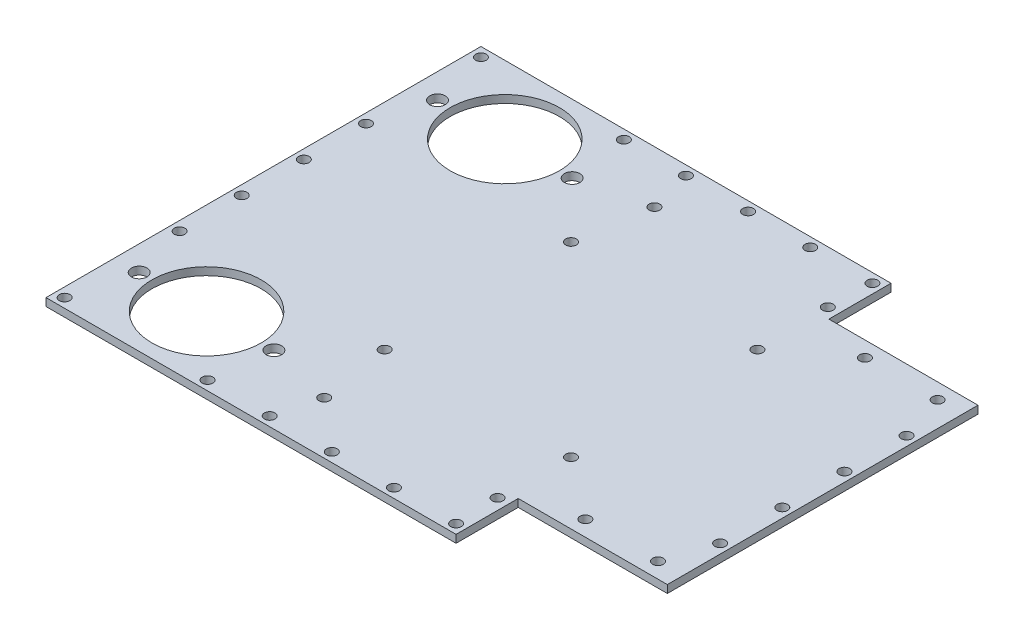
from build123d import *

# Parameters (mm, degrees)
SKETCH1_W           = 228.6
SKETCH1_H           = 177.8
BOSS_EXTRUDE1_DEPTH = 3.175
SKETCH2_R           = 2.1717
SKETCH2_R_2         = 3.175
SKETCH2_R_3         = 22.352
SKETCH2_R_4         = 2.159
SKETCH2_W           = 60.96
SKETCH2_H           = 25.4
CUT_EXTRUDE1_DEPTH  = 3.175


with BuildPart() as part:
    # Sketch1 → Boss-Extrude1 (new body)
    with BuildSketch(Plane(origin=(0, 0, 0), x_dir=(1, 0, 0), z_dir=(0, 1, 0))):
        with Locations((-103.587357149, -18.25946167)):
            Rectangle(SKETCH1_W, SKETCH1_H)
    extrude(amount=BOSS_EXTRUDE1_DEPTH)

    # Sketch2 → Cut-Extrude1 (cut)
    with BuildSketch(Plane(origin=(0, 3.175, 0), x_dir=(1, 0, 0), z_dir=(0, 1, 0))):
        with Locations((0.552642851, 38.89053833)):
            Circle(SKETCH2_R)
        with Locations((-29.165357149, 38.89053833)):
            Circle(SKETCH2_R)
        with Locations((0.552642851, -75.40946167)):
            Circle(SKETCH2_R)
        with Locations((-29.165357149, -75.40946167)):
            Circle(SKETCH2_R)
        with Locations((-207.727357149, 42.70053833)):
            Circle(SKETCH2_R_2)
        with Locations((-152.660157149, 42.70053833)):
            Circle(SKETCH2_R_2)
        with Locations((-180.193757149, 42.70053833)):
            Circle(SKETCH2_R_3)
        with Locations((-207.727357149, -79.21946167)):
            Circle(SKETCH2_R_2)
        with Locations((-180.193757149, -79.21946167)):
            Circle(SKETCH2_R_3)
        with Locations((-152.660157149, -79.21946167)):
            Circle(SKETCH2_R_2)
        with Locations((-54.692357149, 49.24054303)):
            Circle(SKETCH2_R)
        with Locations((-125.558357149, 49.24054303)):
            Circle(SKETCH2_R)
        with Locations((-125.558357149, -85.75946637)):
            Circle(SKETCH2_R)
        with Locations((-54.692357149, -85.75946637)):
            Circle(SKETCH2_R)
        with Locations((-54.057357149, 66.83053833)):
            Circle(SKETCH2_R_4)
        with Locations((-54.057357149, -103.34946167)):
            Circle(SKETCH2_R_4)
        with Locations((-214.077357149, 66.83053833)):
            Circle(SKETCH2_R_4)
        with Locations((-214.077357149, -103.34946167)):
            Circle(SKETCH2_R)
        with Locations((-79.457357149, 66.83053833)):
            Circle(SKETCH2_R)
        with Locations((-104.857357149, 66.83053833)):
            Circle(SKETCH2_R)
        with Locations((-130.257357149, 66.83053833)):
            Circle(SKETCH2_R)
        with Locations((-155.657357149, 66.83053833)):
            Circle(SKETCH2_R)
        with Locations((-79.457357149, -103.34946167)):
            Circle(SKETCH2_R)
        with Locations((-104.857357149, -103.34946167)):
            Circle(SKETCH2_R)
        with Locations((-130.257357149, -103.34946167)):
            Circle(SKETCH2_R)
        with Locations((-155.657357149, -103.34946167)):
            Circle(SKETCH2_R)
        with Locations((-214.077357149, 19.84053833)):
            Circle(SKETCH2_R)
        with Locations((-214.077357149, -5.55946167)):
            Circle(SKETCH2_R)
        with Locations((-214.077357149, -30.95946167)):
            Circle(SKETCH2_R)
        with Locations((-214.077357149, -56.35946167)):
            Circle(SKETCH2_R)
        with Locations((-130.257357149, 19.84053833)):
            Circle(SKETCH2_R)
        with Locations((-130.257357149, -56.35946167)):
            Circle(SKETCH2_R)
        with Locations((6.902642851, 19.84053833)):
            Circle(SKETCH2_R)
        with Locations((6.902642851, -5.55946167)):
            Circle(SKETCH2_R)
        with Locations((6.902642851, -30.95946167)):
            Circle(SKETCH2_R)
        with Locations((6.902642851, -56.35946167)):
            Circle(SKETCH2_R)
        with Locations((-54.057357149, 19.84053833)):
            Circle(SKETCH2_R)
        with Locations((-54.057357149, -56.35946167)):
            Circle(SKETCH2_R)
        with Locations((-19.767357149, -94.45946167)):
            Rectangle(SKETCH2_W, SKETCH2_H)
        with Locations((-19.767357149, 57.94053833)):
            Rectangle(SKETCH2_W, SKETCH2_H)
    extrude(amount=-CUT_EXTRUDE1_DEPTH, mode=Mode.SUBTRACT)


solid = part.part
